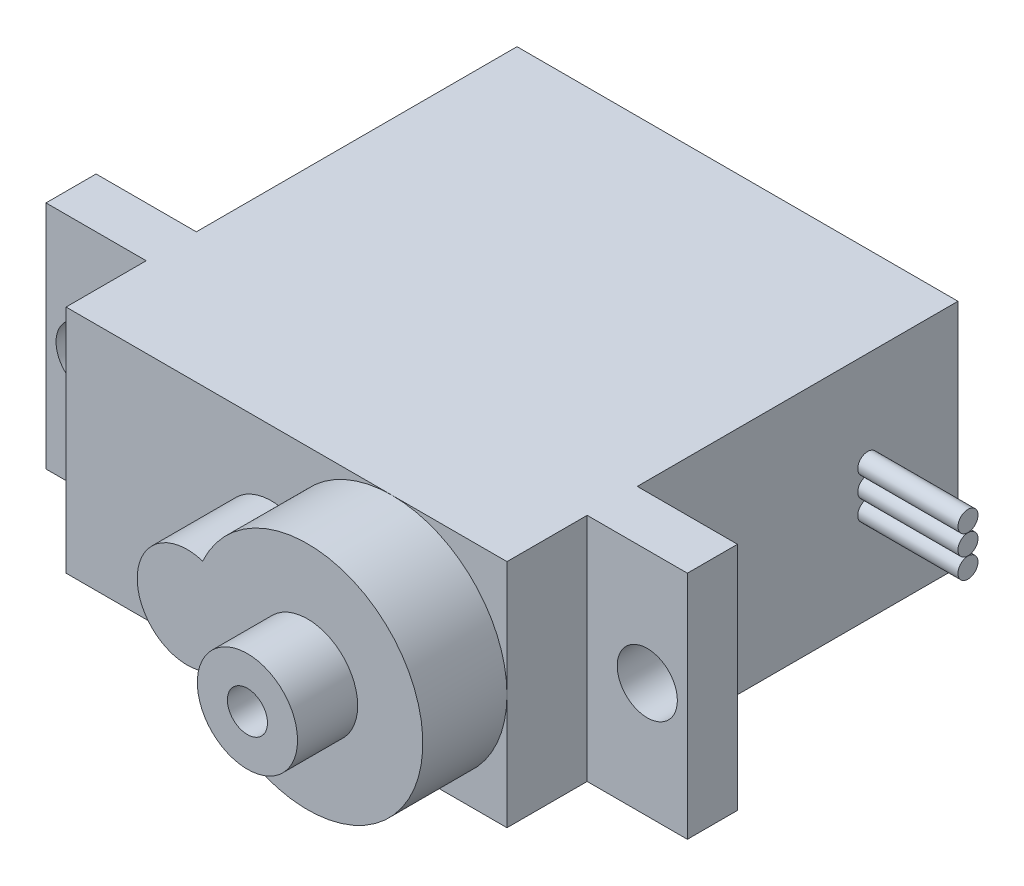
from build123d import *

# Parameters (mm, degrees)
SKETCH_1_W          = 22
SKETCH_1_H          = 11.5
EXTRUDE_1_DEPTH     = 16
SKETCH_2_W          = 32
SKETCH_2_H          = 11.5
EXTRUDE_2_DEPTH     = 2.5
SKETCH_3_W          = 22
SKETCH_3_H          = 11.5
EXTRUDE_3_DEPTH     = 4
EXTRUDE_4_DEPTH     = 4.2
SKETCH_5_R          = 1.5
CUT_EXTRUDE_1_DEPTH = 35.691497517
SKETCH_6_R          = 0.5
EXTRUDE_6_DEPTH     = 5
EXTRUDE_6_2_DEPTH   = 5
EXTRUDE_6_3_DEPTH   = 5
SKETCH_7_R          = 2.5
SKETCH_7_R_2        = 1
EXTRUDE_7_DEPTH     = 3
SKETCH_8_W          = 1.346153846
SKETCH_8_H          = 0.358974359
CUT_EXTRUDE_2_DEPTH = 2


with BuildPart() as part:
    # ｽｹｯﾁ1 → ﾎﾞｽ - 押し出し1 (new body)
    with BuildSketch(Plane.XY):
        with Locations((11, 5.75)):
            Rectangle(SKETCH_1_W, SKETCH_1_H)
    extrude(amount=EXTRUDE_1_DEPTH)

    # ｽｹｯﾁ2 → ﾎﾞｽ - 押し出し2 (add)
    with BuildSketch(Plane.XY.offset(16)):
        with Locations((11, 5.75)):
            Rectangle(SKETCH_2_W, SKETCH_2_H)
    extrude(amount=EXTRUDE_2_DEPTH)

    # ｽｹｯﾁ3 → ﾎﾞｽ - 押し出し3 (add)
    with BuildSketch(Plane.XY.offset(18.5)):
        with Locations((11, 5.75)):
            Rectangle(SKETCH_3_W, SKETCH_3_H)
    extrude(amount=EXTRUDE_3_DEPTH)

    # ｽｹｯﾁ4 → ﾎﾞｽ - 押し出し4 (add)
    with BuildSketch(Plane.XY.offset(22.5)):
        with BuildLine():
            ThreePointArc((11.015625, 8.129877803), (7.75, 5.75), (11.015625, 3.370122197))
            ThreePointArc((11.015625, 3.370122197), (22, 5.75), (11.015625, 8.129877803))
        make_face()
    extrude(amount=EXTRUDE_4_DEPTH)

    # ｽｹｯﾁ5 → ｶｯﾄ - 押し出し1 (cut, through all)
    with BuildSketch(Plane.XY.offset(18.5)):
        with Locations((-3, 5.75)):
            Circle(SKETCH_5_R)
        with Locations((25, 5.75)):
            Circle(SKETCH_5_R)
    extrude(amount=-CUT_EXTRUDE_1_DEPTH, mode=Mode.SUBTRACT)

    # ｽｹｯﾁ8 → ｶｯﾄ - 押し出し2 (cut)
    # profile 1 of 5: a face of its own
    with BuildSketch(Plane.XZ):
        with BuildLine():
            Line((4.284609401, 12.059602692), (4.580482798, 12.236986506))
            add(Edge.make_bspline(
                [(4.580482798, 12.236986506), (4.608001035, 12.190922121), (4.660724916, 12.102664537), (4.748676275, 11.983406497), (4.839809186, 11.88204434), (4.93479852, 11.799167733), (5.033064468, 11.733918846), (5.135248522, 11.687716614), (5.241006332, 11.658900639), (5.312980154, 11.655400552), (5.348912285, 11.653653173)],
                knots=[0, 0, 0, 0, 1.272034388, 2.437168799, 3.508375237, 4.49857839, 5.41946034, 6.295179144, 7.148887113, 8, 8, 8, 8], degree=3))
            add(Edge.make_bspline(
                [(5.348912285, 11.653653173), (5.379599146, 11.654507845), (5.440435919, 11.656202236), (5.529998162, 11.672483038), (5.616979964, 11.697495167), (5.699588602, 11.733316098), (5.776684216, 11.776654584), (5.844290912, 11.829000761), (5.902737025, 11.887606967), (5.950546139, 11.952989622), (5.987226175, 12.02330677), (6.015418243, 12.095482722), (6.031063317, 12.17065129), (6.03342007, 12.221261753), (6.034609401, 12.246802211)],
                knots=[0, 0, 0, 0, 1.095163259, 2.171163733, 3.241058638, 4.321873601, 5.38011039, 6.391990106, 7.366004449, 8.327778327, 9.272591725, 10.192022065, 11.087607919, 12, 12, 12, 12], degree=3))
            add(Edge.make_bspline(
                [(6.034609401, 12.246802211), (6.03313509, 12.275943061), (6.030138032, 12.33518215), (6.004806552, 12.422581803), (5.964957305, 12.509074373), (5.928194661, 12.562575639), (5.909108599, 12.590351891)],
                knots=[0, 0, 0, 0, 0.938893495, 1.908633276, 2.914225137, 4, 4, 4, 4], degree=3))
            add(Edge.make_bspline(
                [(5.909108599, 12.590351891), (5.893437985, 12.610398715), (5.860539491, 12.652484513), (5.803981978, 12.715129749), (5.737615864, 12.779748168), (5.663712309, 12.848807224), (5.57957922, 12.919095021), (5.487851706, 12.993963299), (5.386187847, 13.070564876), (5.31488835, 13.121937442), (5.278098984, 13.14844484)],
                knots=[0, 0, 0, 0, 0.722233717, 1.516239348, 2.393582979, 3.351407094, 4.387010283, 5.505090956, 6.712668013, 8, 8, 8, 8], degree=3))
            add(Edge.make_bspline(
                [(5.278098984, 13.14844484), (5.241274988, 13.174673427), (5.170870311, 13.224820489), (5.072411729, 13.299244774), (4.984367266, 13.367288643), (4.907128249, 13.429592655), (4.840728653, 13.48616526), (4.784645242, 13.536463199), (4.740306684, 13.58184676), (4.715651104, 13.611288102), (4.704581356, 13.624506538)],
                knots=[0, 0, 0, 0, 1.452282411, 2.77665338, 3.964542531, 5.026858415, 5.96415736, 6.766646006, 7.446254459, 8, 8, 8, 8], degree=3))
            add(Edge.make_bspline(
                [(4.704581356, 13.624506538), (4.689108811, 13.645107575), (4.658679974, 13.685622279), (4.618513968, 13.748947137), (4.584374806, 13.813770402), (4.557612473, 13.880266267), (4.535076255, 13.947501196), (4.519918324, 14.016352441), (4.510426927, 14.08651106), (4.50945494, 14.13372456), (4.508968375, 14.157359102)],
                knots=[0, 0, 0, 0, 1.068054152, 2.10047183, 3.106115577, 4.101338837, 5.06977816, 6.043150881, 7.020423561, 8, 8, 8, 8], degree=3))
            add(Edge.make_bspline(
                [(4.508968375, 14.157359102), (4.510273584, 14.194388877), (4.512856104, 14.267656941), (4.534696621, 14.374687771), (4.569169515, 14.476874188), (4.617464403, 14.573204522), (4.679721756, 14.661170503), (4.75176773, 14.74178399), (4.837579216, 14.809552572), (4.93173184, 14.868764631), (5.034788212, 14.915110556), (5.142779115, 14.950071536), (5.255876187, 14.969880794), (5.332479322, 14.972723559), (5.371348183, 14.974165993)],
                knots=[0, 0, 0, 0, 1.005424448, 1.989358655, 2.955360095, 3.929531133, 4.905563448, 5.876582895, 6.856512386, 7.866279853, 8.892233794, 9.918561126, 10.94386622, 12, 12, 12, 12], degree=3))
            add(Edge.make_bspline(
                [(5.371348183, 14.974165993), (5.412592283, 14.972743442), (5.494613635, 14.969914441), (5.61526285, 14.945316909), (5.731423567, 14.904616238), (5.824866832, 14.85842758), (5.897999593, 14.812296164), (5.953772326, 14.77027634), (6.010289777, 14.721901231), (6.068007831, 14.667041985), (6.125948491, 14.605195234), (6.184971943, 14.536784545), (6.245216212, 14.462227989), (6.283972072, 14.409003488), (6.30384017, 14.381718077)],
                knots=[0, 0, 0, 0, 1.286793592, 2.559021753, 3.825965368, 5.121522368, 5.803751409, 6.523245864, 7.299691795, 8.125521123, 9.008227632, 9.944561021, 10.946284179, 12, 12, 12, 12], degree=3))
            Line((6.30384017, 14.381718077), (6.019885843, 14.166473686))
            add(Edge.make_bspline(
                [(6.019885843, 14.166473686), (6.002739911, 14.188562376), (5.969720853, 14.231100029), (5.919591367, 14.290671345), (5.872342719, 14.345087825), (5.825792319, 14.392352953), (5.782398687, 14.435055086), (5.740281645, 14.471614843), (5.700047294, 14.502390438), (5.649330383, 14.535233998), (5.585612665, 14.567790502), (5.505628129, 14.59533958), (5.422041854, 14.611894642), (5.365112222, 14.614083529), (5.336292093, 14.615191635)],
                knots=[0, 0, 0, 0, 1.181633172, 2.275549214, 3.290209073, 4.226197932, 5.078386478, 5.862611352, 6.581680152, 7.217281963, 8.414376989, 9.595101626, 10.782541182, 12, 12, 12, 12], degree=3))
            add(Edge.make_bspline(
                [(5.336292093, 14.615191635), (5.300135571, 14.613979935), (5.230411123, 14.611643285), (5.131420887, 14.5861233), (5.042326962, 14.54594144), (4.965774397, 14.489626462), (4.90203742, 14.422905469), (4.855931961, 14.346126614), (4.828181797, 14.261344211), (4.824795517, 14.202202555), (4.823070939, 14.17208266)],
                knots=[0, 0, 0, 0, 1.14458467, 2.207223713, 3.21896685, 4.227309161, 5.202851033, 6.127160689, 7.046193047, 8, 8, 8, 8], degree=3))
            add(Edge.make_bspline(
                [(4.823070939, 14.17208266), (4.823464066, 14.153331182), (4.824250962, 14.115797562), (4.83522576, 14.06034614), (4.849325089, 14.005034801), (4.87166772, 13.950112218), (4.902513024, 13.894617859), (4.9430182, 13.837596121), (4.994031512, 13.778544413), (5.033108524, 13.740137039), (5.05374001, 13.719859102)],
                knots=[0, 0, 0, 0, 0.858281714, 1.717966888, 2.583508476, 3.4729293, 4.427298488, 5.488583878, 6.674047936, 8, 8, 8, 8], degree=3))
            add(Edge.make_bspline(
                [(5.05374001, 13.719859102), (5.061401382, 13.713022077), (5.079603049, 13.696778868), (5.112878975, 13.670186588), (5.156821773, 13.637383815), (5.210283974, 13.596796499), (5.274251336, 13.549715037), (5.348730892, 13.496741425), (5.432892425, 13.436155966), (5.492614341, 13.393798425), (5.524192734, 13.37140157)],
                knots=[0, 0, 0, 0, 0.420754252, 0.999615792, 1.744751191, 2.668019286, 3.750313428, 4.999500688, 6.413464383, 8, 8, 8, 8], degree=3))
            add(Edge.make_bspline(
                [(5.524192734, 13.37140157), (5.562178647, 13.343760211), (5.635733104, 13.290236549), (5.740390684, 13.209820869), (5.835284492, 13.1311731), (5.920747695, 13.054795493), (5.997624604, 12.9812674), (6.065062324, 12.90970422), (6.123748005, 12.840618647), (6.186927223, 12.752046072), (6.251485043, 12.643264987), (6.30692655, 12.509986749), (6.341884898, 12.376190428), (6.346456413, 12.286263592), (6.348711965, 12.241894359)],
                knots=[0, 0, 0, 0, 1.163667725, 2.253281268, 3.268753668, 4.215851969, 5.092017293, 5.902905408, 6.650798638, 7.335211899, 8.59617414, 9.77448103, 10.901945474, 12, 12, 12, 12], degree=3))
            add(Edge.make_bspline(
                [(6.348711965, 12.241894359), (6.348054827, 12.210515994), (6.346753312, 12.14836861), (6.331792398, 12.057113533), (6.309872733, 11.968482664), (6.276835499, 11.883571551), (6.23651234, 11.800826789), (6.185346093, 11.722418888), (6.126038408, 11.64661249), (6.058004643, 11.575428998), (5.983558741, 11.510082802), (5.904875046, 11.451953741), (5.821824773, 11.403485417), (5.734858456, 11.363934575), (5.64395612, 11.333001058), (5.549148336, 11.310588189), (5.450278825, 11.296832478), (5.383078343, 11.295404716), (5.348912285, 11.294678814)],
                knots=[0, 0, 0, 0, 0.983748083, 1.948392443, 2.894712957, 3.844097841, 4.80183111, 5.778335162, 6.776009319, 7.81870978, 8.863265674, 9.881300176, 10.883814829, 11.87499822, 12.874611388, 13.892143829, 14.928324115, 16, 16, 16, 16], degree=3))
            add(Edge.make_bspline(
                [(5.348912285, 11.294678814), (5.322476942, 11.295189996), (5.269939182, 11.296205921), (5.1922297, 11.305187201), (5.116090111, 11.317894305), (5.042475829, 11.338068375), (4.970438418, 11.362545352), (4.900291183, 11.392683685), (4.832000129, 11.428800886), (4.765182546, 11.470095911), (4.700008372, 11.518153655), (4.637088904, 11.574127152), (4.574359718, 11.636472657), (4.513672322, 11.70688322), (4.453799178, 11.784221303), (4.395920768, 11.869210486), (4.33883905, 11.96138784), (4.303023583, 12.026252926), (4.284609401, 12.059602692)],
                knots=[0, 0, 0, 0, 0.915332311, 1.819136955, 2.706846663, 3.586547465, 4.459518054, 5.340707479, 6.227863349, 7.133153174, 8.059268498, 9.028702269, 10.047606654, 11.120612155, 12.245963614, 13.433783089, 14.680604001, 16, 16, 16, 16], degree=3))
        make_face()
    # profile 2 of 5: a face of its own
    with BuildSketch(Plane.XZ):
        with BuildLine():
            Line((10.342301708, 14.287066635), (10.073070939, 14.031858301))
            add(Edge.make_bspline(
                [(10.073070939, 14.031858301), (10.024352051, 14.077689164), (9.928076005, 14.168258027), (9.771115762, 14.285769022), (9.607352128, 14.386435122), (9.437639631, 14.468341359), (9.266181077, 14.533694119), (9.095252301, 14.58022226), (8.926606599, 14.609894797), (8.814439381, 14.613443166), (8.759168696, 14.615191635)],
                knots=[0, 0, 0, 0, 1.08915593, 2.152340314, 3.188132944, 4.216796309, 5.218260357, 6.173443236, 7.099959455, 8, 8, 8, 8], degree=3))
            add(Edge.make_bspline(
                [(8.759168696, 14.615191635), (8.725253996, 14.614778029), (8.657512555, 14.61395189), (8.556890611, 14.603407674), (8.457323974, 14.58824281), (8.359000599, 14.566300933), (8.261729313, 14.538491873), (8.165848421, 14.50370641), (8.071179066, 14.463151166), (7.978612985, 14.416288692), (7.888872481, 14.364808845), (7.804115646, 14.307760305), (7.723802247, 14.246971515), (7.649441821, 14.180920535), (7.580606635, 14.11020567), (7.515658263, 14.036142364), (7.456880967, 13.956707145), (7.403789802, 13.873361519), (7.356428184, 13.78756933), (7.31461953, 13.70015634), (7.279522442, 13.611412486), (7.251752987, 13.521226408), (7.228842333, 13.430295818), (7.212724726, 13.337991098), (7.203638003, 13.244213413), (7.202066223, 13.181416154), (7.201276067, 13.149847083)],
                knots=[0, 0, 0, 0, 1.02818874, 2.053710826, 3.065248034, 4.081641283, 5.106893873, 6.131558223, 7.173050175, 8.228653731, 9.27666206, 10.308777013, 11.325269123, 12.329503258, 13.32196095, 14.316845687, 15.314881793, 16.315733098, 17.311955233, 18.285320748, 19.252783886, 20.203351036, 21.145449891, 22.095197417, 23.042428769, 24, 24, 24, 24], degree=3))
            add(Edge.make_bspline(
                [(7.201276067, 13.149847083), (7.202031786, 13.117576266), (7.203541159, 13.053122752), (7.213201478, 12.95692868), (7.231129719, 12.862163277), (7.255097427, 12.768515144), (7.285078243, 12.675823896), (7.322450909, 12.584491387), (7.36671651, 12.494520995), (7.417953062, 12.406723378), (7.474139265, 12.321200355), (7.537082346, 12.240640833), (7.60394293, 12.163972056), (7.677156829, 12.092896292), (7.754376372, 12.025512396), (7.837908648, 11.963676874), (7.926111108, 11.906198651), (8.01911832, 11.853802131), (8.115921103, 11.806993596), (8.215177856, 11.7653697), (8.317205671, 11.731090362), (8.421468361, 11.703152258), (8.527841633, 11.680251961), (8.636865435, 11.665519481), (8.747738144, 11.65482865), (8.822476776, 11.65404698), (8.860130234, 11.653653173)],
                knots=[0, 0, 0, 0, 0.93586088, 1.869166235, 2.799637598, 3.729985548, 4.670839027, 5.622275134, 6.589130586, 7.576015415, 8.568469353, 9.55398029, 10.53834874, 11.515998671, 12.510579167, 13.508179873, 14.527009472, 15.561807829, 16.601455013, 17.643573243, 18.680854198, 19.719860599, 20.772568776, 21.833555941, 22.908541556, 24, 24, 24, 24], degree=3))
            add(Edge.make_bspline(
                [(8.860130234, 11.653653173), (8.905508581, 11.654601749), (8.994616339, 11.656464433), (9.125602781, 11.670964722), (9.251405852, 11.693611516), (9.371672055, 11.726777413), (9.486541076, 11.769081088), (9.596434017, 11.820076474), (9.700485676, 11.881719533), (9.799008849, 11.9512934), (9.889766035, 12.028808233), (9.971620159, 12.112452688), (10.043265648, 12.201820755), (10.105770348, 12.29638607), (10.157479002, 12.396931375), (10.199921797, 12.502963937), (10.232455089, 12.614531449), (10.245810063, 12.691623081), (10.252558119, 12.73057625)],
                knots=[0, 0, 0, 0, 1.13008108, 2.219097802, 3.278683437, 4.311054135, 5.322181354, 6.324827112, 7.324222904, 8.330512327, 9.32562643, 10.293043162, 11.24128371, 12.174520618, 13.111833804, 14.052305215, 15.015860969, 16, 16, 16, 16], degree=3))
            Line((10.252558119, 12.73057625), (9.085891452, 12.73057625))
            Line((9.085891452, 12.73057625), (9.085891452, 13.089550609))
            Line((9.085891452, 13.089550609), (10.566660683, 13.089550609))
            add(Edge.make_bspline(
                [(10.566660683, 13.089550609), (10.564954834, 13.02264312), (10.561616181, 12.891693078), (10.538197265, 12.700722807), (10.500380753, 12.520351114), (10.448720441, 12.350388042), (10.381845161, 12.19107445), (10.300472632, 12.042248584), (10.203300511, 11.904871903), (10.09379007, 11.777822899), (9.970890112, 11.664493687), (9.837921492, 11.564887749), (9.694664524, 11.480985134), (9.541254716, 11.412724471), (9.378194283, 11.359450476), (9.205105903, 11.3216789), (9.022224302, 11.299048936), (8.896887625, 11.296157557), (8.832786484, 11.294678814)],
                knots=[0, 0, 0, 0, 1.140356446, 2.231883559, 3.274166699, 4.278491846, 5.25512956, 6.21435461, 7.1637429, 8.11826594, 9.068280886, 10.0076534, 10.945064095, 11.891975133, 12.864533718, 13.863980011, 14.907571808, 16, 16, 16, 16], degree=3))
            add(Edge.make_bspline(
                [(8.832786484, 11.294678814), (8.793276349, 11.295247935), (8.715349628, 11.296370426), (8.6002587, 11.304347773), (8.488341079, 11.316628349), (8.37961307, 11.335173473), (8.273674728, 11.357888127), (8.171055143, 11.386974846), (8.071363401, 11.420643545), (7.974445416, 11.458939219), (7.881180869, 11.503310875), (7.791154352, 11.552620515), (7.703868226, 11.606613876), (7.619917061, 11.666224721), (7.53886344, 11.731007181), (7.461229996, 11.8010911), (7.386582118, 11.87626222), (7.339821654, 11.92964123), (7.316260042, 11.956537788)],
                knots=[0, 0, 0, 0, 1.107784379, 2.184907829, 3.233506516, 4.263428166, 5.276301166, 6.270063455, 7.25232949, 8.225834625, 9.190232166, 10.146266622, 11.1027726, 12.066435141, 13.031522626, 14.010570082, 14.99756817, 16, 16, 16, 16], degree=3))
            add(Edge.make_bspline(
                [(7.316260042, 11.956537788), (7.28207411, 11.999208441), (7.214269697, 12.083841459), (7.126991541, 12.219441403), (7.052590138, 12.359843263), (6.992222316, 12.505437891), (6.945084229, 12.656089104), (6.911277976, 12.811604396), (6.891470687, 12.972184026), (6.88861715, 13.080849291), (6.887173503, 13.135824647)],
                knots=[0, 0, 0, 0, 1.023165419, 2.029347347, 3.013907458, 3.994755782, 4.975994455, 5.96558838, 6.970761222, 8, 8, 8, 8], degree=3))
            add(Edge.make_bspline(
                [(6.887173503, 13.135824647), (6.887705741, 13.1769909), (6.888763453, 13.258800207), (6.901588969, 13.380257515), (6.919990387, 13.499558207), (6.947037442, 13.616604763), (6.981133707, 13.731475355), (7.023687193, 13.844223319), (7.073232089, 13.954915191), (7.130817585, 14.062789059), (7.194902044, 14.166413471), (7.264452265, 14.265371275), (7.340455865, 14.35786034), (7.421671664, 14.445051988), (7.509068655, 14.525850835), (7.601828078, 14.601004946), (7.700021421, 14.670615131), (7.803957601, 14.733584966), (7.912085286, 14.790148587), (8.024145287, 14.839737798), (8.140103398, 14.880721114), (8.259090876, 14.915494893), (8.382008376, 14.941210034), (8.507963913, 14.959858779), (8.637614025, 14.972619379), (8.725250054, 14.973645635), (8.769685523, 14.974165993)],
                knots=[0, 0, 0, 0, 1.008945113, 2.00506715, 2.99143336, 3.967273523, 4.948097931, 5.927297278, 6.919902385, 7.919676788, 8.923139349, 9.905703106, 10.883022732, 11.856032218, 12.825136022, 13.798837087, 14.781400844, 15.773989409, 16.776158564, 17.77167057, 18.775803737, 19.789618931, 20.80898985, 21.851988756, 22.910860228, 24, 24, 24, 24], degree=3))
            add(Edge.make_bspline(
                [(8.769685523, 14.974165993), (8.805923766, 14.973586502), (8.877779945, 14.972437438), (8.984705677, 14.96447279), (9.089978692, 14.951848909), (9.193755082, 14.934622122), (9.295681448, 14.911158431), (9.396048153, 14.883080147), (9.49500069, 14.850388324), (9.592228939, 14.811399478), (9.688386655, 14.767145853), (9.784008495, 14.717332431), (9.878767741, 14.661107426), (9.972828723, 14.59830389), (10.066784581, 14.530000473), (10.159149223, 14.454243649), (10.252152167, 14.374020893), (10.311953981, 14.316338709), (10.342301708, 14.287066635)],
                knots=[0, 0, 0, 0, 0.985871117, 1.954866573, 2.915460327, 3.869826059, 4.81536089, 5.759505086, 6.70452669, 7.649098992, 8.607881297, 9.583363685, 10.581137262, 11.603961102, 12.659522466, 13.73993555, 14.853081303, 16, 16, 16, 16], degree=3))
        make_face()
    # profile 3 of 5: a face of its own
    with BuildSketch(Plane.XZ):
        with Locations((11.64358376, 12.73057625)):
            Rectangle(SKETCH_8_W, SKETCH_8_H)
    # profile 4 of 5: a face of its own
    with BuildSketch(Plane.XZ):
        with BuildLine():
            Line((13.348711965, 11.294678814), (13.097710362, 11.469258141))
            Line((13.097710362, 11.469258141), (14.070867414, 12.891834263))
            add(Edge.make_bspline(
                [(14.070867414, 12.891834263), (14.008776678, 12.884241199), (13.886516558, 12.869290034), (13.763379456, 12.86654338), (13.702778471, 12.865191635)],
                knots=[0, 0, 0, 0, 1.015715272, 2, 2, 2, 2], degree=3))
            add(Edge.make_bspline(
                [(13.702778471, 12.865191635), (13.666036423, 12.866132711), (13.593914997, 12.867979962), (13.487883344, 12.88262177), (13.385997783, 12.905171898), (13.288528428, 12.938820653), (13.195108923, 12.980638862), (13.105943209, 13.032495876), (13.021151319, 13.093502167), (12.941643909, 13.163335159), (12.86933217, 13.240013211), (12.804908872, 13.321168854), (12.75136774, 13.407744825), (12.706891155, 13.497975044), (12.673160701, 13.593156395), (12.648598164, 13.692205795), (12.633475809, 13.795817437), (12.631676714, 13.866342568), (12.630763247, 13.902150769)],
                knots=[0, 0, 0, 0, 1.060718605, 2.082097864, 3.085795603, 4.069760067, 5.054557537, 6.03741023, 7.043284206, 8.066802108, 9.088538119, 10.083643548, 11.053783639, 12.022749082, 12.983451788, 13.964007469, 14.966251758, 16, 16, 16, 16], degree=3))
            add(Edge.make_bspline(
                [(12.630763247, 13.902150769), (12.632497682, 13.951119422), (12.635902025, 14.047234953), (12.663300543, 14.187668722), (12.708360882, 14.320455266), (12.771189259, 14.44524546), (12.85032398, 14.560244199), (12.94543257, 14.663852808), (13.055936534, 14.754597662), (13.179318554, 14.83260174), (13.312671574, 14.895336737), (13.452340232, 14.941576037), (13.597254352, 14.968774785), (13.695422023, 14.972360646), (13.744845779, 14.974165993)],
                knots=[0, 0, 0, 0, 1.022988612, 2.007919123, 2.978103895, 3.94594894, 4.918897164, 5.887013414, 6.875921846, 7.89917871, 8.930658928, 9.948724884, 10.967259574, 12, 12, 12, 12], degree=3))
            add(Edge.make_bspline(
                [(13.744845779, 14.974165993), (13.793334199, 14.97233583), (13.889142745, 14.968719601), (14.030031752, 14.942235632), (14.164972769, 14.897598959), (14.293217756, 14.835914395), (14.411957168, 14.758593487), (14.518732979, 14.666458964), (14.611108518, 14.559453436), (14.688932399, 14.440164946), (14.751402439, 14.311997965), (14.796474722, 14.178214043), (14.824220361, 14.039775321), (14.827716688, 13.945980847), (14.829481196, 13.89864516)],
                knots=[0, 0, 0, 0, 1.026385292, 2.028040595, 3.023318987, 4.028184125, 5.03290303, 6.015178782, 7.004435299, 8.016004309, 9.023023918, 10.015172535, 10.998308025, 12, 12, 12, 12], degree=3))
            add(Edge.make_bspline(
                [(14.829481196, 13.89864516), (14.828302787, 13.861901393), (14.825912679, 13.787375852), (14.809176372, 13.674145509), (14.780756187, 13.55869428), (14.748504488, 13.460972684), (14.71737232, 13.380264235), (14.688071189, 13.316512655), (14.655559035, 13.249411391), (14.61764027, 13.179664053), (14.576877973, 13.106381518), (14.530818696, 13.030298803), (14.480513124, 12.951313809), (14.444683405, 12.898066721), (14.426336164, 12.870800609)],
                knots=[0, 0, 0, 0, 1.179839688, 2.393009684, 3.667231171, 4.993948276, 5.694988576, 6.444077775, 7.246288328, 8.089075292, 8.993003841, 9.939041771, 10.944649915, 12, 12, 12, 12], degree=3))
            Line((14.426336164, 12.870800609), (13.348711965, 11.294678814))
        make_face()
        with BuildLine():
            add(Edge.make_bspline(
                [(13.76097158, 13.224165993), (13.788805594, 13.224926377), (13.842988957, 13.226406586), (13.922366256, 13.235415828), (13.99729046, 13.251389814), (14.067961709, 13.274309526), (14.135088611, 13.301966195), (14.197604939, 13.337178181), (14.255563014, 13.379194816), (14.309350942, 13.426404832), (14.357114941, 13.478855415), (14.399657972, 13.533752522), (14.435818539, 13.591337132), (14.464381816, 13.652330394), (14.487866392, 13.715247603), (14.504084404, 13.781101958), (14.513068737, 13.849550358), (14.514600312, 13.896049016), (14.515378631, 13.919678814)],
                knots=[0, 0, 0, 0, 1.163407946, 2.26475976, 3.333800367, 4.359385343, 5.366239384, 6.363380779, 7.350133999, 8.353570782, 9.349036268, 10.310270964, 11.253520213, 12.184142, 13.120487599, 14.056272588, 15.012232024, 16, 16, 16, 16], degree=3))
            add(Edge.make_bspline(
                [(14.515378631, 13.919678814), (14.514708962, 13.943318479), (14.513389297, 13.989903339), (14.502801997, 14.058453079), (14.484176774, 14.12414634), (14.45918629, 14.18734277), (14.426266052, 14.247523142), (14.386762566, 14.305443014), (14.339830116, 14.360735141), (14.28582755, 14.412099125), (14.227592997, 14.459447024), (14.165532497, 14.5012331), (14.100157581, 14.536254296), (14.031867091, 14.565153266), (13.960518742, 14.587705042), (13.886154754, 14.603922407), (13.808399348, 14.612894161), (13.755618062, 14.614416056), (13.728719978, 14.615191635)],
                knots=[0, 0, 0, 0, 0.972161553, 1.915763587, 2.844109794, 3.775983486, 4.705125789, 5.659731448, 6.655561913, 7.682237399, 8.721216875, 9.739758359, 10.754845918, 11.767244016, 12.7857855, 13.828538656, 14.893392813, 16, 16, 16, 16], degree=3))
            add(Edge.make_bspline(
                [(13.728719978, 14.615191635), (13.702055824, 14.614414803), (13.649740975, 14.612890665), (13.572676816, 14.60393946), (13.498815648, 14.587595976), (13.427674027, 14.565163712), (13.359385567, 14.536252141), (13.294013734, 14.501231265), (13.231938717, 14.459456643), (13.173759997, 14.41206187), (13.119662075, 14.360974224), (13.073536546, 14.305200795), (13.033942653, 14.247553271), (13.001067651, 14.187334763), (12.976065133, 14.124148477), (12.957443132, 14.0584525), (12.946854966, 13.98990349), (12.94553542, 13.94331853), (12.944865811, 13.919678814)],
                knots=[0, 0, 0, 0, 1.099389452, 2.15699305, 3.192601482, 4.213358962, 5.227959689, 6.245255729, 7.266013209, 8.307253147, 9.336162325, 10.327954924, 11.284637477, 12.215801273, 13.149702402, 14.080068371, 15.025723358, 16, 16, 16, 16], degree=3))
            add(Edge.make_bspline(
                [(12.944865811, 13.919678814), (12.945471737, 13.896030615), (12.946666734, 13.849392039), (12.958194524, 13.780865646), (12.977472804, 13.715177452), (13.003292194, 13.651688745), (13.037293785, 13.591016887), (13.079017633, 13.533449525), (13.127923179, 13.478334075), (13.183356666, 13.426526863), (13.244024827, 13.378974688), (13.308821573, 13.337444306), (13.37663141, 13.302371861), (13.447693041, 13.274230477), (13.521479841, 13.251618814), (13.598654972, 13.235445268), (13.67896321, 13.226493002), (13.733373192, 13.224949105), (13.76097158, 13.224165993)],
                knots=[0, 0, 0, 0, 0.952633368, 1.87876736, 2.791047057, 3.707742249, 4.635551637, 5.587206343, 6.568248508, 7.601284464, 8.641511608, 9.671105535, 10.699146789, 11.713763218, 12.747829548, 13.806491675, 14.887386225, 16, 16, 16, 16], degree=3))
        make_face(mode=Mode.SUBTRACT)
    # profile 5 of 5: a face of its own
    with BuildSketch(Plane.XZ):
        with BuildLine():
            add(Edge.make_bspline(
                [(15.278199144, 13.13302016), (15.278527162, 13.189117548), (15.279164342, 13.298087532), (15.286252763, 13.456872174), (15.298028106, 13.605832463), (15.314165479, 13.744975529), (15.333803459, 13.874337294), (15.360018945, 13.993572051), (15.389831748, 14.103231657), (15.424384194, 14.203673706), (15.463371983, 14.296251409), (15.505806244, 14.38267661), (15.553371038, 14.462818543), (15.603347951, 14.537956333), (15.657760023, 14.606860028), (15.715058813, 14.67050269), (15.777480689, 14.727413441), (15.842903698, 14.779259743), (15.911920162, 14.824709215), (15.982562828, 14.864741953), (16.055317934, 14.898941821), (16.130384117, 14.925832257), (16.207086675, 14.948043103), (16.285693741, 14.963232051), (16.366335105, 14.97278896), (16.42076654, 14.973702627), (16.44837142, 14.974165993)],
                knots=[0, 0, 0, 0, 1.646270934, 3.197905019, 4.663502075, 6.030701355, 7.308322542, 8.50163776, 9.611534131, 10.641858119, 11.616356847, 12.558055219, 13.465016945, 14.349605745, 15.204443733, 16.039544428, 16.859896111, 17.680448484, 18.487036065, 19.28249412, 20.06191084, 20.843045899, 21.620316918, 22.403196591, 23.190181807, 24, 24, 24, 24], degree=3))
            add(Edge.make_bspline(
                [(16.44837142, 14.974165993), (16.476206898, 14.973678178), (16.531562907, 14.972708067), (16.613403283, 14.963384125), (16.693352964, 14.947913002), (16.771071103, 14.925992027), (16.847196089, 14.898796351), (16.921132497, 14.864709233), (16.993339579, 14.825030366), (17.062669866, 14.778406489), (17.129884482, 14.726424213), (17.193332445, 14.667661544), (17.25301953, 14.602711824), (17.309694836, 14.532269961), (17.361750433, 14.454984876), (17.411323865, 14.372200766), (17.455695901, 14.282469901), (17.498430576, 14.187289433), (17.535317563, 14.084025775), (17.568583808, 13.973261014), (17.595462777, 13.853686827), (17.617852049, 13.725930582), (17.635196945, 13.589523099), (17.647829587, 13.444756783), (17.654502672, 13.291536392), (17.655759374, 13.186778543), (17.656404273, 13.13302016)],
                knots=[0, 0, 0, 0, 0.810914788, 1.612654377, 2.396697861, 3.181598691, 3.963628158, 4.749916497, 5.551656086, 6.361998678, 7.18212741, 8.025565596, 8.878627764, 9.750805457, 10.657531673, 11.591944965, 12.560506719, 13.57287815, 14.630710178, 15.753379473, 16.941251878, 18.199788006, 19.531962791, 20.947069417, 22.433333509, 24, 24, 24, 24], degree=3))
            add(Edge.make_bspline(
                [(17.656404273, 13.13302016), (17.655752688, 13.079496252), (17.654483102, 12.9752071), (17.647904395, 12.822676125), (17.634945764, 12.678678082), (17.618735776, 12.542867619), (17.596284813, 12.41581), (17.568679647, 12.297065552), (17.538029324, 12.18612148), (17.50019453, 12.083886669), (17.458783819, 11.988934946), (17.413728623, 11.900267797), (17.365458797, 11.817101505), (17.312870052, 11.740101758), (17.256816639, 11.668723101), (17.19609885, 11.604225478), (17.132428265, 11.545054806), (17.065015849, 11.492403179), (16.994604298, 11.446318374), (16.922645221, 11.405104524), (16.847861838, 11.371871829), (16.771948885, 11.343336788), (16.693820519, 11.321536336), (16.613574128, 11.30646248), (16.531617892, 11.295890632), (16.476216327, 11.295084152), (16.44837142, 11.294678814)],
                knots=[0, 0, 0, 0, 1.561518951, 3.042555995, 4.452378317, 5.7783523, 7.031515105, 8.214008947, 9.334062868, 10.386615937, 11.391082383, 12.354592575, 13.286541444, 14.194233754, 15.072674879, 15.931287219, 16.775624067, 17.606195743, 18.42308326, 19.229000347, 20.022332153, 20.807536673, 21.593273796, 22.3848459, 23.188221202, 24, 24, 24, 24], degree=3))
            add(Edge.make_bspline(
                [(16.44837142, 11.294678814), (16.420767306, 11.295145169), (16.366337381, 11.296064731), (16.285684956, 11.305578463), (16.207402512, 11.320873966), (16.131103758, 11.34229057), (16.056397243, 11.368505406), (15.984300957, 11.40265909), (15.914013273, 11.441993159), (15.845721717, 11.48678858), (15.780709556, 11.538110264), (15.71861095, 11.594874552), (15.660985931, 11.658497964), (15.607351836, 11.727975887), (15.556377748, 11.802669129), (15.509488374, 11.883597502), (15.46611752, 11.970440113), (15.42647403, 12.063758023), (15.391325366, 12.164912951), (15.360277658, 12.27506213), (15.3357635, 12.395177766), (15.314780545, 12.524295133), (15.297856162, 12.662969063), (15.286301837, 12.811274841), (15.279160522, 12.96912005), (15.278525451, 13.077389825), (15.278199144, 13.13302016)],
                knots=[0, 0, 0, 0, 0.810891512, 1.598919785, 2.382837074, 3.152667961, 3.926044502, 4.706494248, 5.493654104, 6.291793342, 7.103789334, 7.925228297, 8.761435821, 9.622817696, 10.50288917, 11.416980706, 12.369136599, 13.353924996, 14.394355917, 15.514179734, 16.714354668, 17.994756427, 19.357759367, 20.818452758, 22.365282078, 24, 24, 24, 24], degree=3))
        make_face()
        with BuildLine():
            add(Edge.make_bspline(
                [(15.592301708, 13.134422404), (15.592421155, 13.087673705), (15.592652979, 12.99694366), (15.598709179, 12.865100399), (15.606959411, 12.74213007), (15.617600709, 12.627876534), (15.633403657, 12.522726521), (15.651110445, 12.425956838), (15.672658535, 12.338079601), (15.698153552, 12.25849179), (15.727192649, 12.185842722), (15.758898513, 12.118241507), (15.792959236, 12.05488957), (15.831078386, 11.996355962), (15.87259345, 11.942449798), (15.916566709, 11.892216966), (15.964639293, 11.847419984), (16.031143036, 11.793693129), (16.11893951, 11.738173996), (16.229559965, 11.689827906), (16.343228416, 11.659445449), (16.420379666, 11.655581693), (16.458888247, 11.653653173)],
                knots=[0, 0, 0, 0, 1.459021318, 2.831673884, 4.118529203, 5.306027144, 6.411944654, 7.436330062, 8.375795394, 9.233974572, 10.042671642, 10.816086306, 11.563610507, 12.285937304, 12.993564865, 13.685989202, 14.367179055, 15.041617293, 16.353048772, 17.594441528, 18.799311195, 20, 20, 20, 20], degree=3))
            add(Edge.make_bspline(
                [(16.458888247, 11.653653173), (16.497645919, 11.655250954), (16.575081242, 11.658443217), (16.688215037, 11.689241954), (16.798045307, 11.735711493), (16.884117247, 11.790658999), (16.949599791, 11.842987328), (16.996516781, 11.887601977), (17.039578829, 11.937557844), (17.080420904, 11.99145714), (17.11787998, 12.050329624), (17.151943117, 12.113892199), (17.183026465, 12.182321377), (17.200735511, 12.230091116), (17.209789689, 12.254514551)],
                knots=[0, 0, 0, 0, 1.353760809, 2.704726607, 4.075137775, 5.516104923, 6.260822281, 7.007110065, 7.778089737, 8.566572457, 9.372053459, 10.217411131, 11.088608312, 12, 12, 12, 12], degree=3))
            add(Edge.make_bspline(
                [(17.209789689, 12.254514551), (17.220341457, 12.285744291), (17.241766071, 12.349154055), (17.269377845, 12.447517707), (17.291123244, 12.550720471), (17.31068661, 12.658145588), (17.324039666, 12.770585289), (17.334787479, 12.887691673), (17.341118166, 13.009553035), (17.341902917, 13.092348026), (17.342301708, 13.134422404)],
                knots=[0, 0, 0, 0, 0.884706709, 1.796334032, 2.740027952, 3.714592787, 4.726048262, 5.777819803, 6.87074269, 8, 8, 8, 8], degree=3))
            add(Edge.make_bspline(
                [(17.342301708, 13.134422404), (17.341751519, 13.176489976), (17.340675231, 13.258783141), (17.336561244, 13.379301322), (17.325937669, 13.493769083), (17.31413855, 13.602679555), (17.296741329, 13.705429858), (17.277983522, 13.802880163), (17.25278231, 13.893823188), (17.225862535, 13.97968277), (17.19505214, 14.059483424), (17.161136405, 14.133597211), (17.124914647, 14.202381935), (17.085572406, 14.265648877), (17.043576723, 14.32368142), (16.997819174, 14.375316014), (16.950114801, 14.422152983), (16.883297615, 14.475615552), (16.795823325, 14.530127247), (16.686977678, 14.580293007), (16.573707034, 14.6091013), (16.49713358, 14.613162987), (16.458888247, 14.615191635)],
                knots=[0, 0, 0, 0, 1.31362396, 2.569729283, 3.763502607, 4.902122613, 5.988968491, 7.01645872, 7.998833611, 8.933434873, 9.825090667, 10.667526885, 11.477055099, 12.250526234, 12.991942729, 13.710640831, 14.402115721, 15.076753259, 16.378508321, 17.609869233, 18.806226677, 20, 20, 20, 20], degree=3))
            add(Edge.make_bspline(
                [(16.458888247, 14.615191635), (16.420177655, 14.613160188), (16.342685949, 14.609093594), (16.228237994, 14.58040034), (16.118533643, 14.530387374), (16.031290668, 14.475435002), (15.964426882, 14.42309669), (15.917344188, 14.377710236), (15.873198016, 14.328063982), (15.832530316, 14.273662067), (15.794441033, 14.2151967), (15.75946002, 14.152207935), (15.72794269, 14.084376571), (15.698858154, 14.011760135), (15.673285366, 13.932179191), (15.652191403, 13.844410197), (15.63270435, 13.747948306), (15.618909081, 13.642228798), (15.606645325, 13.527946644), (15.598763977, 13.404669326), (15.59263272, 13.272604946), (15.592414255, 13.181405787), (15.592301708, 13.134422404)],
                knots=[0, 0, 0, 0, 1.207732386, 2.417664972, 3.655092373, 4.956220595, 5.625982001, 6.301752483, 6.994047911, 7.697131622, 8.419323945, 9.170223765, 9.943494443, 10.752040957, 11.610060368, 12.549350801, 13.567764191, 14.679664412, 15.874934091, 17.154273443, 18.533957287, 20, 20, 20, 20], degree=3))
        make_face(mode=Mode.SUBTRACT)
    extrude(amount=-CUT_EXTRUDE_2_DEPTH, mode=Mode.SUBTRACT)


with BuildPart() as body_2:
    # ｽｹｯﾁ6 → ﾎﾞｽ - 押し出し6 (new body)
    with BuildSketch(Plane(origin=(22, 0, 0), x_dir=(0, 0, -1), z_dir=(1, 0, 0))):
        with Locations((-4.5, 5.75)):
            Circle(SKETCH_6_R)
    extrude(amount=EXTRUDE_6_DEPTH)


with BuildPart() as body_3:
    # ｽｹｯﾁ6 → Extrude 6 2 (new body)
    with BuildSketch(Plane(origin=(22, 0, 0), x_dir=(0, 0, -1), z_dir=(1, 0, 0))):
        with Locations((-4.5, 6.76)):
            Circle(SKETCH_6_R)
    extrude(amount=EXTRUDE_6_2_DEPTH)


with BuildPart() as body_4:
    # ｽｹｯﾁ6 → Extrude 6 3 (new body)
    with BuildSketch(Plane(origin=(22, 0, 0), x_dir=(0, 0, -1), z_dir=(1, 0, 0))):
        with Locations((-4.5, 4.74)):
            Circle(SKETCH_6_R)
    extrude(amount=EXTRUDE_6_3_DEPTH)


with BuildPart() as body_5:
    # ｽｹｯﾁ7 → ﾎﾞｽ - 押し出し7 (new body)
    with BuildSketch(Plane.XY.offset(26.7)):
        with Locations((16.25, 5.75)):
            Circle(SKETCH_7_R)
        with Locations((16.25, 5.75)):
            Circle(SKETCH_7_R_2, mode=Mode.SUBTRACT)
    extrude(amount=EXTRUDE_7_DEPTH)


solid = Compound([part.part, body_2.part, body_3.part, body_4.part, body_5.part])
